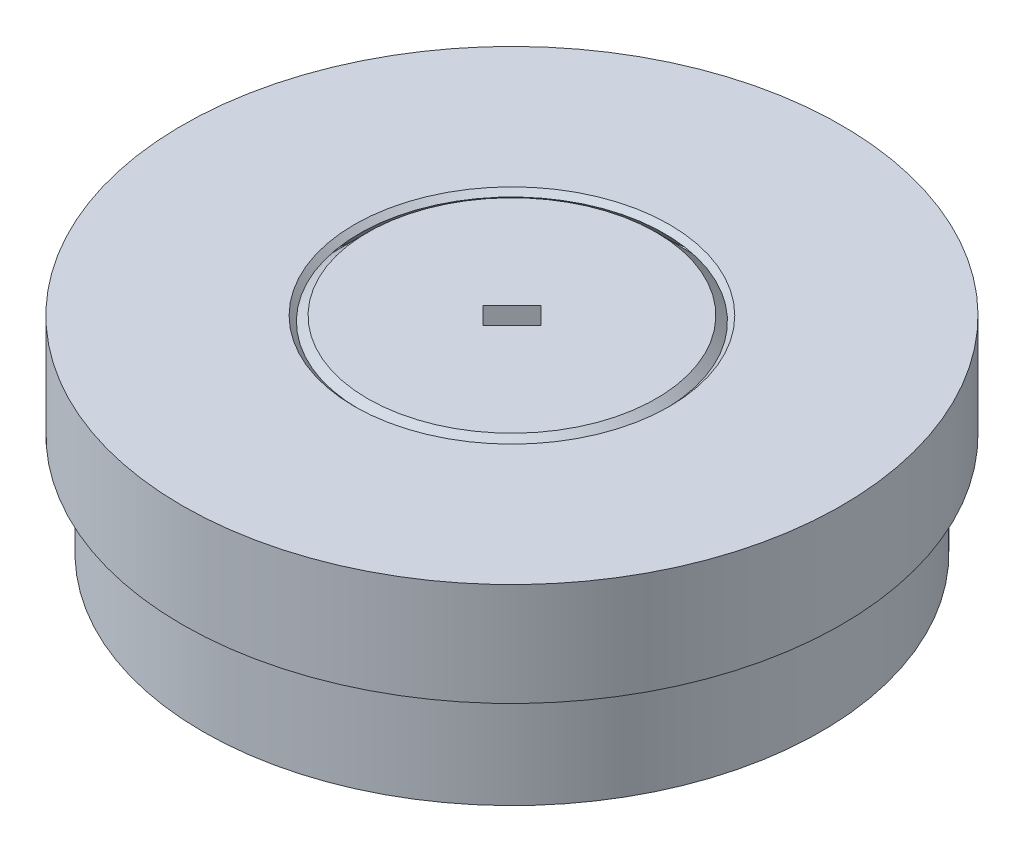
from build123d import *

# Parameters (mm, degrees)
SKETCH3_W             = 4
SKETCH3_H             = 4
BOSS_EXTRUDE1_DEPTH   = 3
SKETCH3_R             = 15
BOSS_EXTRUDE1_2_DEPTH = 3
FILLET2_R             = 0.5
FILLET3_R             = 0.5
CHAMFER1_SIZE         = 0.5
CHAMFER2_SIZE         = 0.5
CHAMFER2_SIZE2        = 0.353553391
CUT_EXTRUDE1_DEPTH    = 25.738633754


with BuildPart() as part:
    # Sketch3 → Boss-Extrude1 (new body)
    with BuildSketch(Plane(origin=(0, 0, 0), x_dir=(1, 0, 0), z_dir=(0, 1, 0))):
        Rectangle(SKETCH3_W, SKETCH3_H)
    extrude(amount=BOSS_EXTRUDE1_DEPTH)



with BuildPart() as body_2:
    # Sketch3 → Boss-Extrude1 2 (new body)
    with BuildSketch(Plane(origin=(0, 0, 0), x_dir=(1, 0, 0), z_dir=(0, 1, 0))):
        Circle(SKETCH3_R)
        with BuildLine():
            Line((0, 14), (6e-09, 11.000000002))
            add(Edge.make_bspline(
                [(0, 11), (0.056616489, 11.024574893), (0.170211242, 11.072370306), (0.437910475, 11.181792108), (0.663717143, 11.261861254), (0.97104166, 11.368516349), (1.234006284, 11.447229474), (1.52724598, 11.530520118), (1.805632628, 11.59890918), (2.095927746, 11.664153072), (2.381719097, 11.719222841), (2.672472662, 11.768403485), (2.962285544, 11.809180066), (3.254181451, 11.843127284), (3.594521396, 11.873714193), (4.008991563, 11.898575905), (4.497887113, 11.908766934), (4.985854779, 11.89703643), (5.426150855, 11.86840958), (5.789797413, 11.833835811), (6.08388825, 11.798119807), (6.441560531, 11.747794011), (6.813058519, 11.681533461), (7.156111535, 11.612501996), (7.536443848, 11.520476808), (7.779225286, 11.459012875), (8.050487558, 11.380265176), (8.170023598, 11.344456359), (8.228993532, 11.326237921)],
                knots=[0.074515509, 0.074515509, 0.074515509, 0.074515509, 0.074515509, 0.103872078, 0.133228686, 0.162585325, 0.191941925, 0.221298528, 0.250655154, 0.280011777, 0.309368359, 0.338724992, 0.36808162, 0.397438205, 0.426794822, 0.456151457, 0.50487246, 0.563585682, 0.622298905, 0.65165552, 0.681012134, 0.710368753, 0.739725372, 0.798438577, 0.827795195, 0.857151813, 0.88650843, 0.915865049, 0.915865049, 0.915865049, 0.915865049, 0.915865049], degree=4))
            Line((8.228993538, 11.326237921), (6.465637787, 8.899186936))
            add(Edge.make_bspline(
                [(6.465637788, 8.899186936), (6.52588625, 8.885790105), (6.645879774, 8.857688085), (6.926769524, 8.788862522), (7.156514419, 8.720913992), (7.467835468, 8.626558958), (7.726844732, 8.535672485), (8.013037641, 8.430694063), (8.278455252, 8.32239041), (8.551658334, 8.204542638), (8.815237592, 8.081111075), (9.079369825, 7.949998395), (9.337801244, 7.812639603), (9.593903667, 7.668531371), (9.887223001, 7.493229899), (10.237149757, 7.269723995), (10.638664701, 6.990603116), (11.026543819, 6.694292741), (11.365924387, 6.412333593), (11.63979868, 6.170616742), (11.856729825, 5.968859631), (12.116512018, 5.717910715), (12.378113229, 5.445943765), (12.615073272, 5.188454633), (12.868677528, 4.890450968), (13.028964244, 4.698022252), (13.202133296, 4.474870063), (13.277792089, 4.3756386), (13.314791239, 4.326237916)],
                knots=[0.074515508, 0.074515508, 0.074515508, 0.074515508, 0.074515508, 0.103872078, 0.133228686, 0.162585325, 0.191941925, 0.221298528, 0.250655154, 0.280011777, 0.309368359, 0.338724992, 0.36808162, 0.397438205, 0.426794822, 0.456151457, 0.50487246, 0.563585682, 0.622298905, 0.65165552, 0.681012134, 0.710368753, 0.739725372, 0.798438577, 0.827795195, 0.857151813, 0.88650843, 0.915865048, 0.915865048, 0.915865048, 0.915865048, 0.915865048], degree=4))
            Line((13.314791238, 4.326237917), (10.461621693, 3.399186929))
            add(Edge.make_bspline(
                [(10.461621694, 3.399186928), (10.502489264, 3.352935507), (10.583048111, 3.259670072), (10.769838042, 3.038886168), (10.915766422, 2.848873992), (11.112169944, 2.589549245), (11.268291112, 2.363778718), (11.438121271, 2.110629419), (11.589189339, 1.867001366), (11.740946093, 1.611075773), (11.881634939, 1.356289541), (12.018256305, 1.094964124), (12.146594243, 0.831936349), (12.269080761, 0.564817113), (12.403341467, 0.250586464), (12.555064686, -0.135915397), (12.715833963, -0.597733494), (12.855467892, -1.065443248), (12.96430111, -1.493035883), (13.043792468, -1.849568194), (13.100703597, -2.140302053), (13.163367733, -2.496020133), (13.215149396, -2.869811352), (13.255505784, -3.217406053), (13.285513777, -3.607560925), (13.302081693, -3.857453194), (13.311012833, -4.139773322), (13.313895292, -4.264524385), (13.31479124, -4.326237932)],
                knots=[0.074515508, 0.074515508, 0.074515508, 0.074515508, 0.074515508, 0.103872078, 0.133228686, 0.162585325, 0.191941925, 0.221298528, 0.250655154, 0.280011777, 0.309368359, 0.338724992, 0.36808162, 0.397438205, 0.426794822, 0.456151457, 0.50487246, 0.563585682, 0.622298905, 0.65165552, 0.681012134, 0.710368753, 0.739725372, 0.798438577, 0.827795195, 0.857151813, 0.88650843, 0.915865048, 0.915865048, 0.915865048, 0.915865048, 0.915865048], degree=4))
            Line((13.31479124, -4.326237931), (10.461621691, -3.399186954))
            add(Edge.make_bspline(
                [(10.461621691, -3.399186955), (10.467498346, -3.460626496), (10.477851776, -3.583431121), (10.499194481, -3.871841417), (10.505566666, -4.111339047), (10.512033191, -4.436580268), (10.505633283, -4.710998181), (10.494231343, -5.015623928), (10.473247001, -5.301518746), (10.445591505, -5.597767282), (10.409651583, -5.886588503), (10.366577363, -6.17830923), (10.315801089, -6.466538317), (10.257886016, -6.754638088), (10.181805068, -7.087772486), (10.077371636, -7.48963973), (9.935986847, -7.957756229), (9.774040173, -8.418216133), (9.610755451, -8.828116402), (9.465500875, -9.163280948), (9.340653871, -9.431941104), (9.182264381, -9.75655613), (9.004447661, -10.089396077), (8.832785625, -10.394326987), (8.627735322, -10.727607164), (8.494256057, -10.939512634), (8.335537893, -11.173164008), (8.264543016, -11.275784004), (8.228993541, -11.326237937)],
                knots=[0.074515508, 0.074515508, 0.074515508, 0.074515508, 0.074515508, 0.103872078, 0.133228686, 0.162585325, 0.191941925, 0.221298528, 0.250655154, 0.280011777, 0.309368359, 0.338724992, 0.36808162, 0.397438205, 0.426794822, 0.456151457, 0.50487246, 0.563585682, 0.622298905, 0.65165552, 0.681012134, 0.710368753, 0.739725372, 0.798438577, 0.827795195, 0.857151813, 0.88650843, 0.915865048, 0.915865048, 0.915865048, 0.915865048, 0.915865048], degree=4))
            Line((8.228993541, -11.326237937), (6.465637781, -8.899186959))
            add(Edge.make_bspline(
                [(6.465637781, -8.89918696), (6.434278838, -8.952346803), (6.370472192, -9.057783425), (6.218215484, -9.303657183), (6.082597515, -9.501160313), (5.89665705, -9.768086915), (5.730180614, -9.986333899), (5.541901729, -10.226079414), (5.356880282, -10.445038893), (5.160375995, -10.6684535), (4.961535133, -10.88098982), (4.755218216, -11.091678455), (4.544722541, -11.295015139), (4.328527466, -11.494051125), (4.071165201, -11.718843255), (3.750465139, -11.982576254), (3.360930468, -12.278186563), (2.959261315, -12.555516584), (2.586227867, -12.791156516), (2.27170967, -12.976931832), (2.012791845, -13.120899235), (1.69384813, -13.290419303), (1.35435297, -13.45517443), (1.036241574, -13.600968305), (0.674455221, -13.750072088), (0.441913317, -13.843050071), (0.176170794, -13.938785807), (0.058416211, -13.980077387), (3e-09, -14.000000019)],
                knots=[0.074515508, 0.074515508, 0.074515508, 0.074515508, 0.074515508, 0.103872078, 0.133228686, 0.162585325, 0.191941925, 0.221298528, 0.250655154, 0.280011777, 0.309368359, 0.338724992, 0.36808162, 0.397438205, 0.426794822, 0.456151457, 0.50487246, 0.563585682, 0.622298905, 0.65165552, 0.681012134, 0.710368753, 0.739725372, 0.798438577, 0.827795195, 0.857151813, 0.88650843, 0.915865048, 0.915865048, 0.915865048, 0.915865048, 0.915865048], degree=4))
            Line((4e-09, -14.000000018), (-1e-09, -11.000000021))
            add(Edge.make_bspline(
                [(-2e-09, -11.000000021), (-0.056616492, -11.024574914), (-0.170211245, -11.072370327), (-0.437910477, -11.181792129), (-0.663717146, -11.261861275), (-0.971041662, -11.36851637), (-1.234006287, -11.447229494), (-1.527245982, -11.530520138), (-1.80563263, -11.5989092), (-2.095927749, -11.664153092), (-2.3817191, -11.719222861), (-2.672472665, -11.768403505), (-2.962285547, -11.809180085), (-3.254181454, -11.843127304), (-3.594521399, -11.873714213), (-4.008991566, -11.898575924), (-4.497887115, -11.908766953), (-4.985854782, -11.897036449), (-5.426150858, -11.868409599), (-5.789797416, -11.833835829), (-6.083888253, -11.798119826), (-6.441560534, -11.747794029), (-6.813058522, -11.681533479), (-7.156111538, -11.612502014), (-7.53644385, -11.520476826), (-7.779225289, -11.459012893), (-8.050487561, -11.380265194), (-8.1700236, -11.344456376), (-8.228993535, -11.326237939)],
                knots=[0.074515508, 0.074515508, 0.074515508, 0.074515508, 0.074515508, 0.103872078, 0.133228686, 0.162585325, 0.191941925, 0.221298528, 0.250655154, 0.280011777, 0.309368359, 0.338724992, 0.36808162, 0.397438205, 0.426794822, 0.456151457, 0.50487246, 0.563585682, 0.622298905, 0.65165552, 0.681012134, 0.710368753, 0.739725372, 0.798438577, 0.827795195, 0.857151813, 0.88650843, 0.915865048, 0.915865048, 0.915865048, 0.915865048, 0.915865048], degree=4))
            Line((-8.228993534, -11.326237939), (-6.465637783, -8.899186955))
            add(Edge.make_bspline(
                [(-6.465637784, -8.899186954), (-6.525886246, -8.885790123), (-6.64587977, -8.857688104), (-6.92676952, -8.78886254), (-7.156514415, -8.72091401), (-7.467835464, -8.626558976), (-7.726844728, -8.535672503), (-8.013037637, -8.430694081), (-8.278455248, -8.322390428), (-8.55165833, -8.204542656), (-8.815237588, -8.081111094), (-9.07936982, -7.949998414), (-9.33780124, -7.812639622), (-9.593903663, -7.668531389), (-9.887222997, -7.493229917), (-10.237149753, -7.269724013), (-10.638664697, -6.990603135), (-11.026543815, -6.694292759), (-11.365924383, -6.412333611), (-11.639798676, -6.17061676), (-11.856729821, -5.96885965), (-12.116512014, -5.717910733), (-12.378113225, -5.445943783), (-12.615073268, -5.188454652), (-12.868677524, -4.890450986), (-13.02896424, -4.69802227), (-13.202133292, -4.474870081), (-13.277792085, -4.375638618), (-13.314791235, -4.326237934)],
                knots=[0.074515508, 0.074515508, 0.074515508, 0.074515508, 0.074515508, 0.103872078, 0.133228686, 0.162585325, 0.191941925, 0.221298528, 0.250655154, 0.280011777, 0.309368359, 0.338724992, 0.36808162, 0.397438205, 0.426794822, 0.456151457, 0.50487246, 0.563585682, 0.622298905, 0.65165552, 0.681012134, 0.710368753, 0.739725372, 0.798438577, 0.827795195, 0.857151813, 0.88650843, 0.915865048, 0.915865048, 0.915865048, 0.915865048, 0.915865048], degree=4))
            Line((-13.314791234, -4.326237935), (-10.461621689, -3.399186947))
            add(Edge.make_bspline(
                [(-10.46162169, -3.399186947), (-10.502489259, -3.352935525), (-10.583048107, -3.25967009), (-10.769838038, -3.038886187), (-10.915766418, -2.84887401), (-11.11216994, -2.589549263), (-11.268291108, -2.363778736), (-11.438121266, -2.110629438), (-11.589189335, -1.867001384), (-11.740946088, -1.611075792), (-11.881634935, -1.356289559), (-12.0182563, -1.094964142), (-12.146594239, -0.831936368), (-12.269080757, -0.564817131), (-12.403341463, -0.250586483), (-12.555064681, 0.135915379), (-12.715833959, 0.597733476), (-12.855467888, 1.06544323), (-12.964301106, 1.493035865), (-13.043792463, 1.849568176), (-13.100703592, 2.140302035), (-13.163367729, 2.496020115), (-13.215149392, 2.869811334), (-13.25550578, 3.217406035), (-13.285513773, 3.607560907), (-13.302081689, 3.857453176), (-13.311012829, 4.139773304), (-13.313895287, 4.264524367), (-13.314791235, 4.326237914)],
                knots=[0.074515508, 0.074515508, 0.074515508, 0.074515508, 0.074515508, 0.103872078, 0.133228686, 0.162585325, 0.191941925, 0.221298528, 0.250655154, 0.280011777, 0.309368359, 0.338724992, 0.36808162, 0.397438205, 0.426794822, 0.456151457, 0.50487246, 0.563585682, 0.622298905, 0.65165552, 0.681012134, 0.710368753, 0.739725372, 0.798438577, 0.827795195, 0.857151813, 0.88650843, 0.915865048, 0.915865048, 0.915865048, 0.915865048, 0.915865048], degree=4))
            Line((-13.314791235, 4.326237913), (-10.461621687, 3.399186936))
            add(Edge.make_bspline(
                [(-10.461621687, 3.399186937), (-10.467498342, 3.460626478), (-10.477851772, 3.583431102), (-10.499194477, 3.871841399), (-10.505566662, 4.111339029), (-10.512033187, 4.43658025), (-10.505633279, 4.710998163), (-10.494231339, 5.01562391), (-10.473246997, 5.301518728), (-10.4455915, 5.597767264), (-10.409651578, 5.886588485), (-10.366577358, 6.178309212), (-10.315801085, 6.466538299), (-10.257886012, 6.75463807), (-10.181805064, 7.087772468), (-10.077371632, 7.489639712), (-9.935986843, 7.957756211), (-9.774040169, 8.418216115), (-9.610755447, 8.828116384), (-9.465500871, 9.16328093), (-9.340653867, 9.431941085), (-9.182264377, 9.756556112), (-9.004447657, 10.089396058), (-8.832785621, 10.394326969), (-8.627735318, 10.727607146), (-8.494256053, 10.939512615), (-8.335537889, 11.173163989), (-8.264543012, 11.275783986), (-8.228993536, 11.326237919)],
                knots=[0.074515508, 0.074515508, 0.074515508, 0.074515508, 0.074515508, 0.103872078, 0.133228686, 0.162585325, 0.191941925, 0.221298528, 0.250655154, 0.280011777, 0.309368359, 0.338724992, 0.36808162, 0.397438205, 0.426794822, 0.456151457, 0.50487246, 0.563585682, 0.622298905, 0.65165552, 0.681012134, 0.710368753, 0.739725372, 0.798438577, 0.827795195, 0.857151813, 0.88650843, 0.915865048, 0.915865048, 0.915865048, 0.915865048, 0.915865048], degree=4))
            Line((-8.228993537, 11.326237918), (-6.465637777, 8.89918694))
            add(Edge.make_bspline(
                [(-6.465637777, 8.899186941), (-6.434278834, 8.952346785), (-6.370472187, 9.057783407), (-6.21821548, 9.303657165), (-6.082597511, 9.501160294), (-5.896657046, 9.768086897), (-5.73018061, 9.986333881), (-5.541901725, 10.226079395), (-5.356880278, 10.445038875), (-5.160375991, 10.668453482), (-4.961535129, 10.880989802), (-4.755218212, 11.091678437), (-4.544722537, 11.295015121), (-4.328527462, 11.494051107), (-4.071165196, 11.718843236), (-3.750465135, 11.982576235), (-3.360930464, 12.278186545), (-2.959261311, 12.555516565), (-2.586227863, 12.791156497), (-2.271709666, 12.976931814), (-2.012791841, 13.120899217), (-1.693848126, 13.290419284), (-1.354352966, 13.455174411), (-1.03624157, 13.600968287), (-0.674455217, 13.75007207), (-0.441913313, 13.843050053), (-0.176170789, 13.938785789), (-0.058416207, 13.980077368), (1e-09, 14)],
                knots=[0.074515508, 0.074515508, 0.074515508, 0.074515508, 0.074515508, 0.103872078, 0.133228686, 0.162585325, 0.191941925, 0.221298528, 0.250655154, 0.280011777, 0.309368359, 0.338724992, 0.36808162, 0.397438205, 0.426794822, 0.456151457, 0.50487246, 0.563585682, 0.622298905, 0.65165552, 0.681012134, 0.710368753, 0.739725372, 0.798438577, 0.827795195, 0.857151813, 0.88650843, 0.915865048, 0.915865048, 0.915865048, 0.915865048, 0.915865048], degree=4))
        make_face(mode=Mode.SUBTRACT)
    extrude(amount=BOSS_EXTRUDE1_2_DEPTH)


with BuildPart() as part_1:
    add(part.part)

    add(body_2.part)  # Revolve1 merges body 2
    # Sketch5 → Revolve1 (revolve)
    with BuildSketch(Plane(origin=(0, 0, 0), x_dir=(0, 0, -1), z_dir=(1, 0, 0))):
        Polygon((-7, 10), (-9.5, 7.5), (-7, 5), (-7, 3), (0, 3), (0, 10), align=None)
        Polygon((-7.15, 10), (-9.65, 7.5), (-7.15, 5), (-9.65, 5), (-9.65, 3), (-15, 3), (-15, 5), (-16, 5), (-16, 10), align=None)
    revolve(axis=Axis((0, 10, 0), (0, -1, 0)))

    # Fillet2
    fillet2_edges = [part_1.edges().sort_by_distance(p)[0] for p in [
        (0, 3, -9.65),
    ]]
    fillet(fillet2_edges, radius=FILLET2_R)

    # Fillet3
    fillet3_edges = [part_1.edges().sort_by_distance(p)[0] for p in [
        (0, 3, -7),
    ]]
    fillet(fillet3_edges, radius=FILLET3_R)

    # Chamfer1
    chamfer1_edges = [part_1.edges().sort_by_distance(p)[0] for p in [
        (2, 0, 0),
        (0, 0, -2),
        (-2, 0, 0),
        (0, 0, 2),
    ]]
    chamfer(chamfer1_edges, length=CHAMFER1_SIZE)

    # Chamfer2
    chamfer2_edges = [part_1.edges().sort_by_distance(p)[0] for p in [
        (0, 10, -7.15),
    ]]
    chamfer2_side = [part_1.faces().sort_by_distance(p)[0] for p in [
        (0, 10, -15.54745166),
    ]]
    chamfer(chamfer2_edges, length=CHAMFER2_SIZE, length2=CHAMFER2_SIZE2, reference=chamfer2_side[0])

    # Sketch6 → Cut-Extrude1 (cut, through all)
    with BuildSketch(Plane.XZ):
        Polygon((-0.282842712, 1.13137085), (1.13137085, -0.282842712), (0.282842712, -1.13137085), (-1.13137085, 0.282842712), align=None)
    extrude(amount=-CUT_EXTRUDE1_DEPTH, mode=Mode.SUBTRACT)


solid = part_1.part
